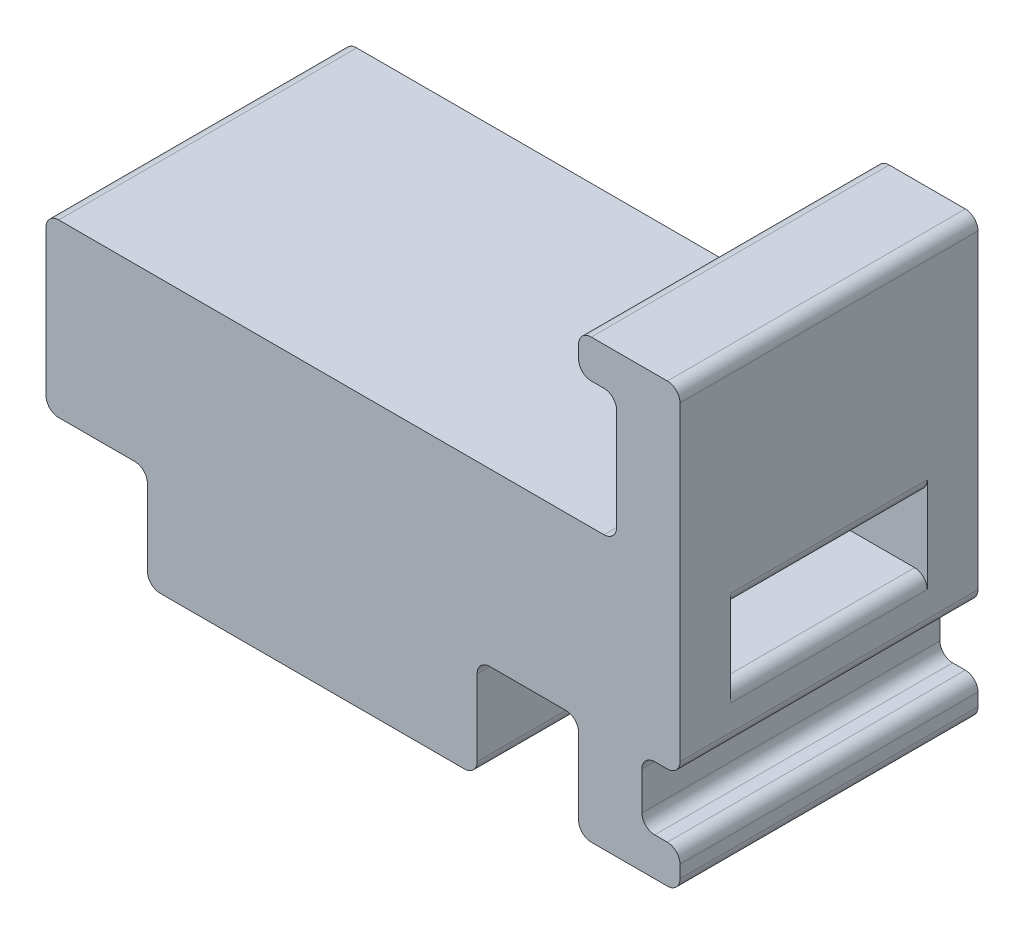
from build123d import *

# Parameters (mm, degrees)
BOSS_EXTRUDE2_DEPTH = 11.75
SKETCH5_W           = 15.5
SKETCH5_H           = 5.5
CUT_EXTRUDE2_DEPTH  = 56.302011717
FILLET1_R           = 1
CUT_EXTRUDE3_DEPTH  = 10
CUT_EXTRUDE4_DEPTH  = 1


with BuildPart() as part:
    # Sketch1 → Boss-Extrude2 (new, symmetric)
    with BuildSketch(Plane.XY):
        with BuildLine():
            Line((-25, 6.5), (-25, -5))
            ThreePointArc((-25, -5), (-24.707106781, -5.707106781), (-24, -6))
            Line((-24, -6), (-18, -6))
            ThreePointArc((-18, -6), (-17.292893219, -6.292893219), (-17, -7))
            Line((-17, -7), (-17, -13))
            ThreePointArc((-17, -13), (-16.707106781, -13.707106781), (-16, -14))
            Line((-16, -14), (-4, -14))
            Line((-4, -14), (8, -14))
            ThreePointArc((8, -14), (8.707106781, -13.707106781), (9, -13))
            Line((9, -13), (9, -7))
            ThreePointArc((9, -7), (9.292893219, -6.292893219), (10, -6))
            Line((10, -6), (16, -6))
            ThreePointArc((16, -6), (16.707106781, -6.292893219), (17, -7))
            Line((17, -7), (17, -11))
            Line((17, -11), (17, -13))
            ThreePointArc((17, -13), (17.292893219, -13.707106781), (18, -14))
            Line((18, -14), (24, -14))
            ThreePointArc((24, -14), (24.707106781, -13.707106781), (25, -13))
            Line((25, -13), (25, -12))
            ThreePointArc((25, -12), (24.707106781, -11.292893219), (24, -11))
            Line((24, -11), (23, -11))
            ThreePointArc((23, -11), (22.292893219, -10.707106781), (22, -10))
            Line((22, -10), (22, -7))
            ThreePointArc((22, -7), (22.292893219, -6.292893219), (23, -6))
            Line((23, -6), (24, -6))
            ThreePointArc((24, -6), (24.707106781, -5.707106781), (25, -5))
            Line((25, -5), (25, 8.5))
            Line((25, 8.5), (25, 16))
            Line((25, 16), (25, 19.5))
            ThreePointArc((25, 19.5), (24.707106781, 20.207106781), (24, 20.5))
            Line((24, 20.5), (18, 20.5))
            ThreePointArc((18, 20.5), (17.292893219, 20.207106781), (17, 19.5))
            Line((17, 19.5), (17, 18.5))
            ThreePointArc((17, 18.5), (17.292893219, 17.792893219), (18, 17.5))
            Line((18, 17.5), (19, 17.5))
            ThreePointArc((19, 17.5), (19.707106781, 17.207106781), (20, 16.5))
            Line((20, 16.5), (20, 8.5))
            ThreePointArc((20, 8.5), (19.707106781, 7.792893219), (19, 7.5))
            Line((19, 7.5), (-24, 7.5))
            ThreePointArc((-24, 7.5), (-24.707106781, 7.207106781), (-25, 6.5))
        make_face()
    extrude(amount=BOSS_EXTRUDE2_DEPTH, both=True)

    # Sketch5 → Cut-Extrude2 (cut, through all)
    with BuildSketch(Plane.ZY.offset(25)):
        with Locations((0, 0.75)):
            Rectangle(SKETCH5_W, SKETCH5_H)
    extrude(amount=-CUT_EXTRUDE2_DEPTH, mode=Mode.SUBTRACT)

    # Fillet1
    fillet1_edges = [part.edges().sort_by_distance(p)[0] for p in [
        (25, -2, 0),
        (25, 3.5, 0),
        (-25, -2, 0),
        (-25, 3.5, 0),
    ]]
    fillet(fillet1_edges, radius=FILLET1_R)

    # Sketch7 → Cut-Extrude3 (cut)
    with BuildSketch(Plane.XZ.offset(14)):
        with BuildLine():
            Line((-9.099019514, 5.5), (1.099019514, 5.5))
            ThreePointArc((1.099019514, 5.5), (-4, -7.5), (-9.099019514, 5.5))
        make_face()
    extrude(amount=-CUT_EXTRUDE3_DEPTH, mode=Mode.SUBTRACT)

    # Sketch8 → Cut-Extrude4 (cut, symmetric)
    with BuildSketch(Plane(origin=(0, -7.75, 0), x_dir=(1, 0, 0), z_dir=(0, 1, 0))):
        with BuildLine():
            Line((1.477225575, -6.5), (-9.477225575, -6.5))
            ThreePointArc((-9.477225575, -6.5), (-4, 8.5), (1.477225575, -6.5))
        make_face()
    extrude(amount=CUT_EXTRUDE4_DEPTH, both=True, mode=Mode.SUBTRACT)


solid = part.part
